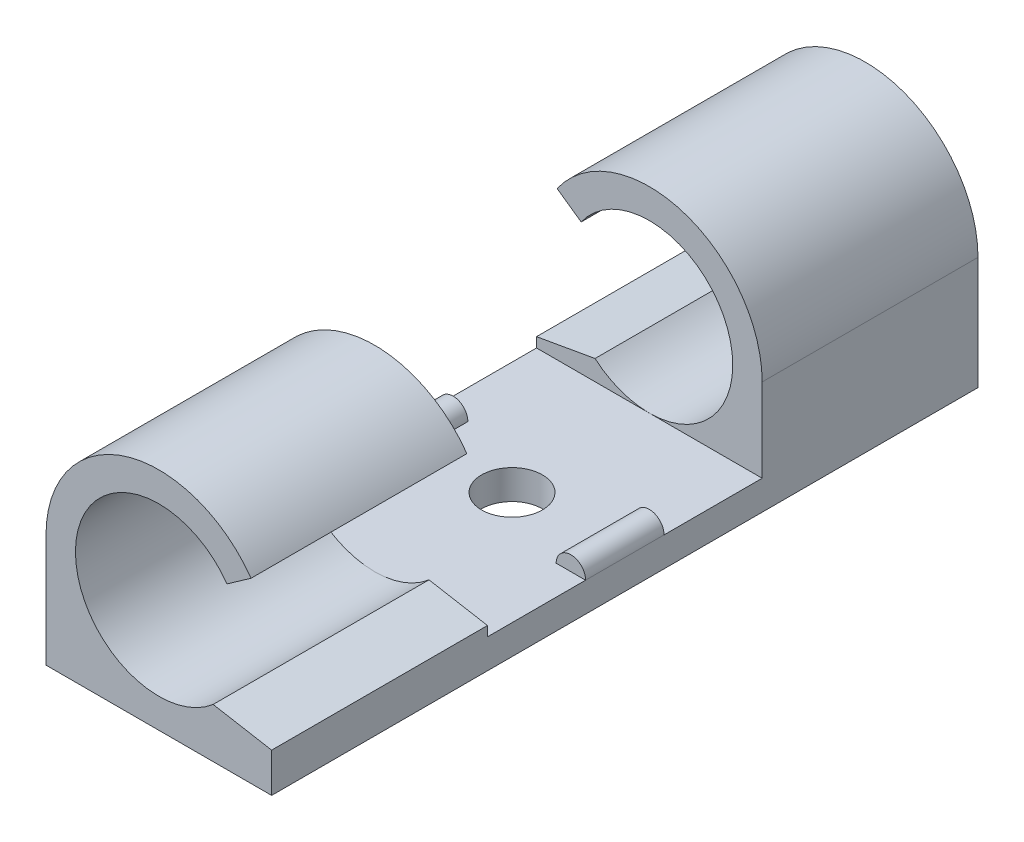
from build123d import *

# Parameters (mm, degrees)
ESBO_O1_R                = 4.25
RESSALTO_EXTRUS_O1_DEPTH = 11
ESBO_O2_W                = 11.5
ESBO_O2_H                = 1.5
RESSALTO_EXTRUS_O2_DEPTH = 7
RESSALTO_EXTRUS_O3_DEPTH = 2
ESBO_O4_R                = 1.55
CORTE_EXTRUS_O1_DEPTH    = 2
CORTE_EXTRUS_O2_DEPTH    = 12
CORTE_EXTRUS_O3_DEPTH    = 12


with BuildPart() as part:
    # Esboço1 → Ressalto-extrusão1 (new body)
    with BuildSketch(Plane.XY):
        with BuildLine():
            Line((-5.75, 0), (-5.75, -5.75))
            Line((-5.75, -5.75), (5.75, -5.75))
            Line((5.75, -5.75), (5.75, 0))
            ThreePointArc((5.75, 0), (0, 5.75), (-5.75, 0))
        make_face()
        Circle(ESBO_O1_R, mode=Mode.SUBTRACT)
    ressalto_extrus_o1 = extrude(amount=RESSALTO_EXTRUS_O1_DEPTH)

    # Esboço2 → Ressalto-extrusão2 (add)
    with BuildSketch(Plane.XY.offset(11)):
        with Locations((0, -5)):
            Rectangle(ESBO_O2_W, ESBO_O2_H)
    ressalto_extrus_o2 = extrude(amount=RESSALTO_EXTRUS_O2_DEPTH)

    # Esboço3 → Ressalto-extrusão3 (add)
    with BuildSketch(Plane.XY.offset(18)):
        with BuildLine():
            Line((4.25, -4.25), (5.75, -4.25))
            ThreePointArc((5.75, -4.25), (5, -3.5), (4.25, -4.25))
        make_face()
        with BuildLine():
            Line((-5.75, -4.25), (-4.25, -4.25))
            ThreePointArc((-4.25, -4.25), (-5, -3.5), (-5.75, -4.25))
        make_face()
    ressalto_extrus_o3 = extrude(amount=-RESSALTO_EXTRUS_O3_DEPTH)

    # Espelhar1: Ressalto-extrusão1, Ressalto-extrusão2, Ressalto-extrusão3 across plane
    add(ressalto_extrus_o1.mirror(Plane(origin=(0, 0, 18), x_dir=(1, 0, 0), z_dir=(0, 0, -1))))
    add(ressalto_extrus_o2.mirror(Plane(origin=(0, 0, 18), x_dir=(1, 0, 0), z_dir=(0, 0, -1))))
    add(ressalto_extrus_o3.mirror(Plane(origin=(0, 0, 18), x_dir=(1, 0, 0), z_dir=(0, 0, -1))))

    # Esboço4 → Corte-extrusão1 (cut)
    with BuildSketch(Plane(origin=(0, -4.25, 0), x_dir=(1, 0, 0), z_dir=(0, 1, 0))):
        with Locations((0, -18)):
            Circle(ESBO_O4_R)
    extrude(amount=-CORTE_EXTRUS_O1_DEPTH, mode=Mode.SUBTRACT)

    # Esboço5 → Corte-extrusão2 (cut)
    with BuildSketch(Plane.XY.offset(36)):
        with BuildLine():
            Line((4.700679969, 3.311511411), (3.474415629, 2.447638869))
            ThreePointArc((3.474415629, 2.447638869), (4.051466798, 1.283790009), (4.25, 0))
            ThreePointArc((4.25, 0), (3.8619844, -1.774141058), (2.768787532, -3.224331807))
            Line((2.768787532, -3.224331807), (5.75, -3.75))
            Line((5.75, -3.75), (5.75, 0))
            ThreePointArc((5.75, 0), (5.481396256, 1.736892365), (4.700679969, 3.311511411))
        make_face()
    extrude(amount=-CORTE_EXTRUS_O2_DEPTH, mode=Mode.SUBTRACT)

    # Esboço6 → Corte-extrusão3 (cut)
    with BuildSketch(Plane(origin=(0, 0, 0), x_dir=(-1, 0, 0), z_dir=(0, 0, -1))):
        with BuildLine():
            Line((2.768787532, -3.224331807), (5.75, -3.75))
            Line((5.75, -3.75), (5.75, 0))
            ThreePointArc((5.75, 0), (5.481452901, 1.73671359), (4.700895968, 3.311204781))
            Line((4.700895968, 3.311204781), (3.474575281, 2.447412229))
            ThreePointArc((3.474575281, 2.447412229), (4.051508666, 1.283657871), (4.25, 0))
            ThreePointArc((4.25, 0), (3.8619844, -1.774141058), (2.768787532, -3.224331807))
        make_face()
    extrude(amount=-CORTE_EXTRUS_O3_DEPTH, mode=Mode.SUBTRACT)


solid = part.part
